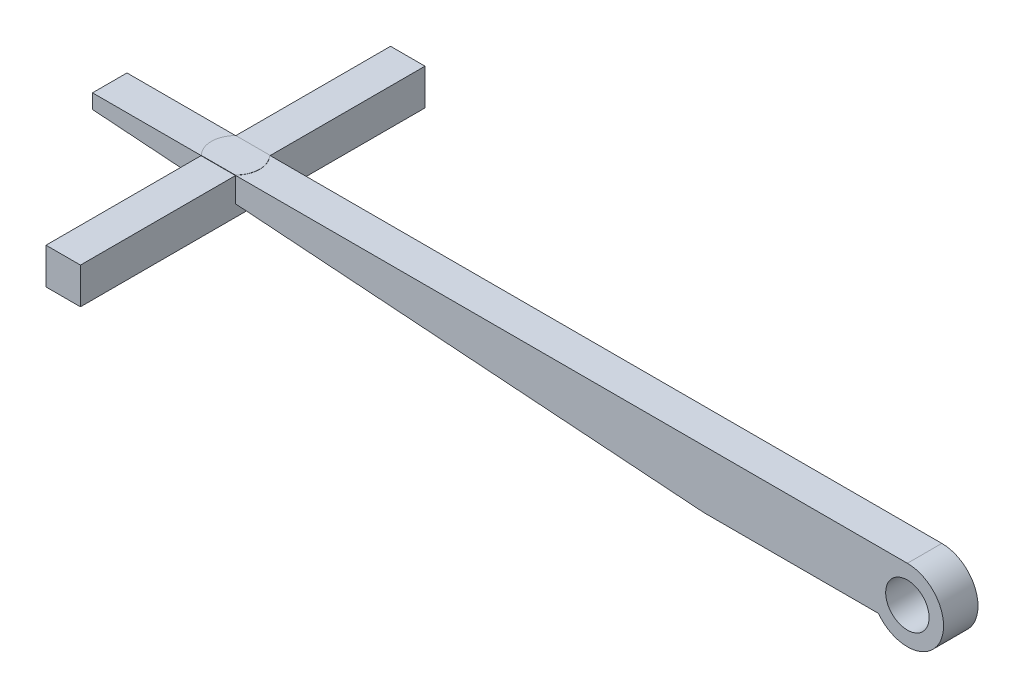
from build123d import *

# Parameters (mm, degrees)
SKETCH1_R             = 6.3
BOSS_EXTRUDE2_DEPTH   = 10
BODY_MOVE_COPY1_ANGLE = 90
BOSS_EXTRUDE4_DEPTH   = 10.5
BOSS_EXTRUDE5_DEPTH   = 0.05


with BuildPart() as part:
    # Sketch1 → Boss-Extrude2 (new body)
    with BuildSketch(Plane.XY):
        with BuildLine():
            Line((10.394563839, -1.484265), (10.5, 0))
            ThreePointArc((10.5, 0), (0, 10.5), (-10.5, 0))
            Line((-10.5, 0), (-10.5, -236.5))
            Line((-10.5, -236.5), (-6.3, -236.5))
            Line((-6.3, -236.5), (6.3, -59.125))
            Line((6.3, -59.125), (6.3, -8.4))
            ThreePointArc((6.3, -8.4), (9.035151526, -5.349395938), (10.394563839, -1.484265))
        make_face()
        Circle(SKETCH1_R, mode=Mode.SUBTRACT)
    extrude(amount=BOSS_EXTRUDE2_DEPTH)


with BuildPart() as part_1:
    # Body-Move/Copy1: moved
    add(part.part.rotate(Axis((-34.8, -34.75, 0), (0, 0, -1)), BODY_MOVE_COPY1_ANGLE))


with BuildPart() as part_2:
    # Body-Move/Copy2: moved
    add(part_1.part.moved(Location((0, 69.6, 0))))

    # Sketch3 → Boss-Extrude4 (add)
    with BuildSketch(Plane(origin=(0, 0, 0), x_dir=(1, 0, 0), z_dir=(0, 1, 0))):
        Polygon((-195.05, -55), (-195.05, -5), (-195.05, 45), (-205.05, 45), (-205.05, -45), (-205.05, -55), align=None)
    extrude(amount=BOSS_EXTRUDE4_DEPTH)

    # Sketch4 → Boss-Extrude5 (add)
    with BuildSketch(Plane(origin=(0, 10.55, 0), x_dir=(1, 0, 0), z_dir=(0, 1, 0))):
        with BuildLine():
            ThreePointArc((-195.151020514, -10), (-193.596595612, -7.711747002), (-193.05, -5))
            ThreePointArc((-193.05, -5), (-193.596595612, -2.288252998), (-195.151020514, 0))
            Line((-195.151020514, 0), (-204.948979486, 0))
            ThreePointArc((-204.948979486, 0), (-207.05, -5), (-204.948979486, -10))
            Line((-204.948979486, -10), (-195.151020514, -10))
        make_face()
    extrude(amount=BOSS_EXTRUDE5_DEPTH)


with BuildPart() as part_3:
    # Body-Move/Copy4: moved
    add(part_2.part.moved(Location((0, 0, -5))))


solid = part_3.part
